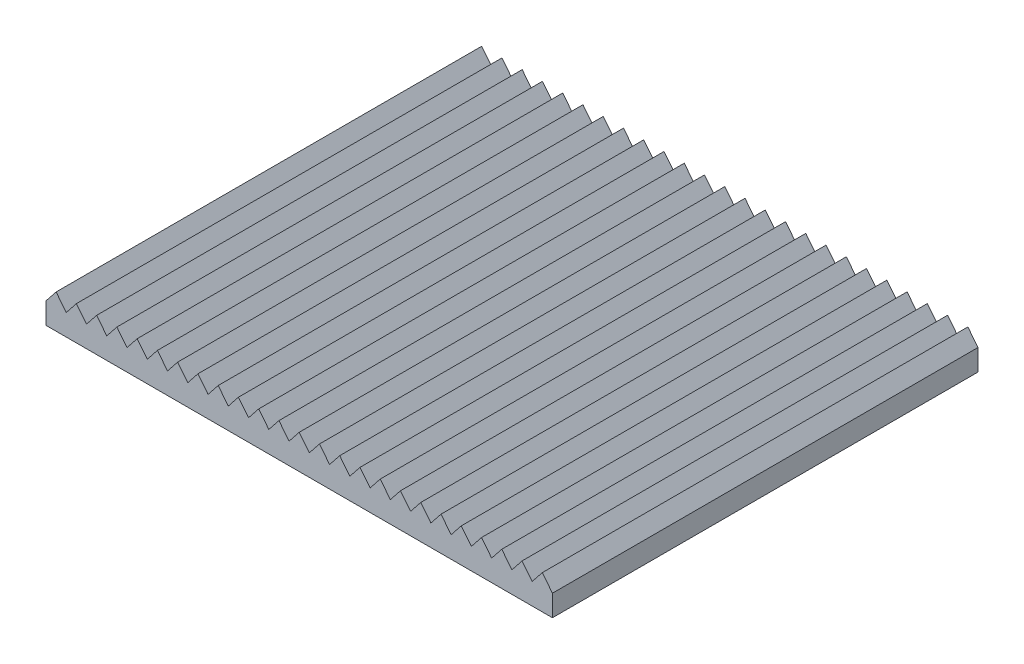
from build123d import *

# Parameters (mm, degrees)
SKETCH1_W           = 59.5
SKETCH1_H           = 50
SKETCH1_R           = 3
BOSS_EXTRUDE1_DEPTH = 1.5
BOSS_EXTRUDE2_DEPTH = 50
CUT_EXTRUDE1_DEPTH  = 2
CHAMFER1_SIZE       = 2


with BuildPart() as part:
    # Sketch1 → Boss-Extrude1 (new body)
    with BuildSketch(Plane(origin=(0, 0, 0), x_dir=(1, 0, 0), z_dir=(0, 1, 0))):
        Rectangle(SKETCH1_W, SKETCH1_H)
        with Locations(Location((0, 0, 0), (0, 0, 270))):
            Circle(SKETCH1_R, mode=Mode.SUBTRACT)
    extrude(amount=BOSS_EXTRUDE1_DEPTH)

    # Sketch2 → Boss-Extrude2 (add)
    with BuildSketch(Plane(origin=(0, 0, -25), x_dir=(-1, 0, 0), z_dir=(0, 0, -1))):
        Polygon((-29.75, 1.5), (29.75, 1.5), (29.75, 2.5), (28.56, 4), (27.37, 2.5), (26.18, 4), (24.99, 2.5), (23.8, 4), (22.61, 2.5), (21.42, 4), (20.23, 2.5), (19.04, 4), (17.85, 2.5), (16.66, 4), (15.47, 2.5), (14.28, 4), (13.09, 2.5), (11.9, 4), (10.71, 2.5), (9.52, 4), (8.33, 2.5), (7.14, 4), (5.95, 2.5), (4.76, 4), (3.57, 2.5), (2.38, 4), (1.19, 2.5), (0, 4), (-1.19, 2.5), (-2.38, 4), (-3.57, 2.5), (-4.76, 4), (-5.95, 2.5), (-7.14, 4), (-8.33, 2.5), (-9.52, 4), (-10.71, 2.5), (-11.9, 4), (-13.09, 2.5), (-14.28, 4), (-15.47, 2.5), (-16.66, 4), (-17.85, 2.5), (-19.04, 4), (-20.23, 2.5), (-21.42, 4), (-22.61, 2.5), (-23.8, 4), (-24.99, 2.5), (-26.18, 4), (-27.37, 2.5), (-28.56, 4), (-29.75, 2.5), align=None)
    extrude(amount=-BOSS_EXTRUDE2_DEPTH)

    # Sketch3 → Cut-Extrude1 (cut)
    with BuildSketch(Plane(origin=(0, 0, 0), x_dir=(-1, 0, 0), z_dir=(0, -1, 0))):
        with BuildLine():
            Line((-1.75, -2.436698586), (-1.75, -5))
            Line((-1.75, -5), (1.75, -5))
            Line((1.75, -5), (1.75, -2.436698586))
            ThreePointArc((1.75, -2.436698586), (0, 3), (-1.75, -2.436698586))
        make_face()
    extrude(amount=-CUT_EXTRUDE1_DEPTH, mode=Mode.SUBTRACT)

    # Chamfer1
    chamfer1_edges = [part.edges().sort_by_distance(p)[0] for p in [
        (0, 0, 5),
    ]]
    chamfer(chamfer1_edges, length=CHAMFER1_SIZE - 0.0001)  # a hair under: the kernel refuses the full size


solid = part.part
